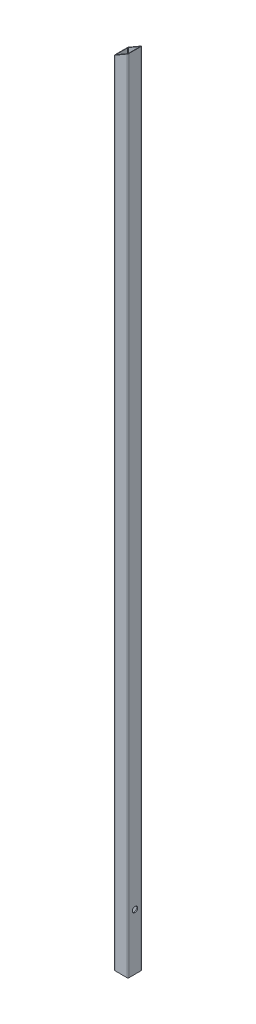
from build123d import *

# Parameters (mm, degrees)
EXTRUDE_START         = -150
EXTRUDE_1_DEPTH       = 2855.29255553
EXTRUDE_START_2       = -2356
EXTRUDE_1_2_OUTLINE_W = 61
EXTRUDE_1_2_OUTLINE_H = 53
EXTRUDE_1_2_DEPTH     = 25.647922242
SKETCH_2_R            = 9.5
CUT_EXTRUDE_1_DEPTH   = 2706.870065433


with BuildPart() as part:
    # Бобышка-Вытянуть1: read off the stored shape, not the designer's step
    # Бобышка-Вытянуть1 outline → Бобышка-Вытянуть1 (new body)
    with BuildSketch(Plane(origin=(0, 0, 0), x_dir=(1, 0, 0), z_dir=(0, 1, 0)).offset(EXTRUDE_START)):
        with BuildLine():
            Line((-25, 22), (-25, -22))
            ThreePointArc((-25, -22), (-24.121320344, -24.121320344), (-22, -25))
            Line((-22, -25), (22, -25))
            ThreePointArc((22, -25), (24.121320344, -24.121320344), (25, -22))
            Line((25, -22), (25, 22))
            ThreePointArc((25, 22), (24.121320344, 24.121320344), (22, 25))
            Line((22, 25), (-22, 25))
            ThreePointArc((-22, 25), (-24.121320344, 24.121320344), (-25, 22))
        make_face()
        with BuildLine():
            ThreePointArc((-20, -22), (-21.414213562, -21.414213562), (-22, -20))
            Line((-22, -20), (-22, 20))
            ThreePointArc((-22, 20), (-21.414213562, 21.414213562), (-20, 22))
            Line((-20, 22), (20, 22))
            ThreePointArc((20, 22), (21.414213562, 21.414213562), (22, 20))
            Line((22, 20), (22, -20))
            ThreePointArc((22, -20), (21.414213562, -21.414213562), (20, -22))
            Line((20, -22), (-20, -22))
        make_face(mode=Mode.SUBTRACT)
    extrude(amount=EXTRUDE_1_DEPTH)

    # Extrude 1 2 outline → Extrude 1 2 (cut)
    with BuildSketch(Plane(origin=(0, 0, 0), x_dir=(0.8660254037844386, 0.4999999999999999, 0), z_dir=(0.4999999999999999, -0.8660254037844388, 0)).offset(EXTRUDE_START_2)):
        with Locations((1345.5, -0.5)):
            Rectangle(EXTRUDE_1_2_OUTLINE_W, EXTRUDE_1_2_OUTLINE_H)
    extrude(amount=EXTRUDE_1_2_DEPTH, mode=Mode.SUBTRACT)

    # Эскиз2 → Вырез-Вытянуть1 (cut, through all)
    with BuildSketch(Plane(origin=(25, 0, 0), x_dir=(0, 0, -1), z_dir=(1, 0, 0))):
        with Locations((0, 50)):
            Circle(SKETCH_2_R)
    extrude(amount=-CUT_EXTRUDE_1_DEPTH, mode=Mode.SUBTRACT)


solid = part.part
